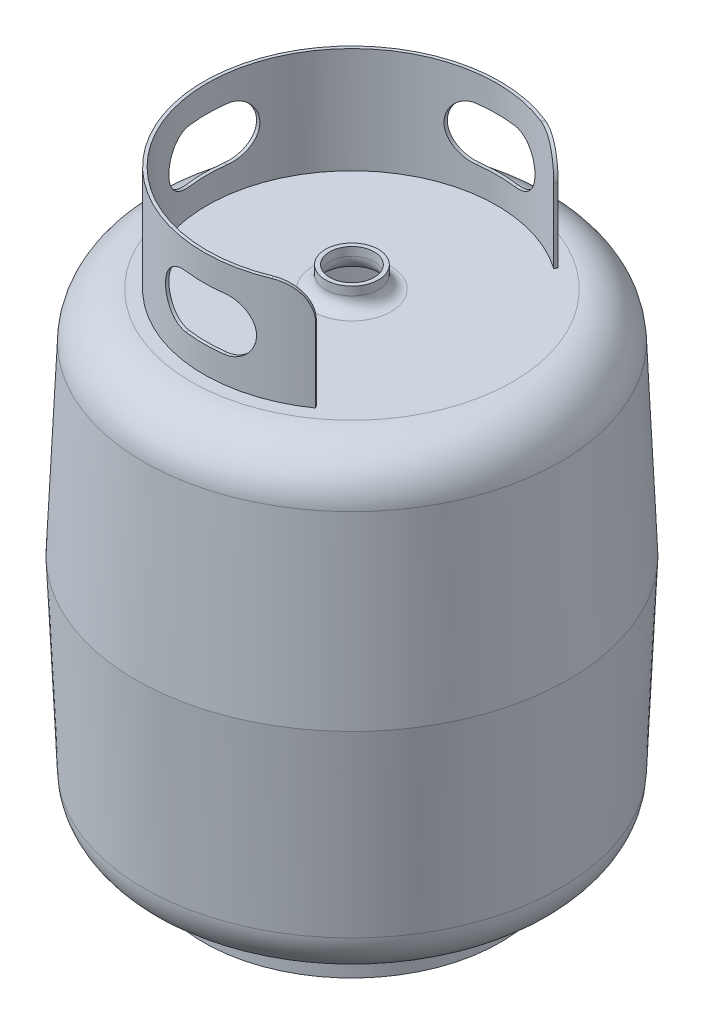
from build123d import *

# Parameters (mm, degrees)
ESQUISSE2_R                  = 139.921871599
ESQUISSE2_R_2                = 136.921871599
BOSS_EXTRU_1_DEPTH           = 30
BOSS_EXTRU_2_START           = 100
BOSS_EXTRU_2_DEPTH           = 100
CONG_1_R                     = 30
ENL_V_MAT_EXTRU_1_DEPTH      = 609.163166258
R_P_TITION_CIRCULAIRE1_COUNT = 3
R_P_TITION_CIRCULAIRE1_ANGLE = 180


with BuildPart() as part:
    # Esquisse1 → Révolution2 (revolve)
    with BuildSketch(Plane.XY, mode=Mode.PRIVATE) as r_volution2_sk:
        with BuildLine():
            Line((0, 0), (151.921871599, 0))
            ThreePointArc((151.921871599, 0), (183.039959109, 12.493621707), (196.87904157, 43.037127569))
            Line((196.87904157, 43.037127569), (204.496255083, 217.5))
            Line((204.496255083, 217.5), (196.87904157, 391.962872431))
            ThreePointArc((196.87904157, 391.962872431), (183.039959109, 422.506378293), (151.921871599, 435))
            Line((151.921871599, 435), (37, 435))
            ThreePointArc((37, 435), (28.514718626, 438.514718626), (25, 447))
            Line((25, 447), (25, 455))
            Line((25, 455), (21, 455))
            Line((21, 455), (21, 447))
            ThreePointArc((21, 447), (25.686291501, 435.686291501), (37, 431))
            Line((37, 431), (151.921871599, 431))
            ThreePointArc((151.921871599, 431), (180.273906886, 419.616922444), (192.882848683, 391.788394882))
            Line((192.882848683, 391.788394882), (200.492444342, 217.5))
            Line((200.492444342, 217.5), (192.882848683, 43.211605118))
            ThreePointArc((192.882848683, 43.211605118), (180.273906886, 15.383077556), (151.921871599, 4))
            Line((151.921871599, 4), (0, 4))
            Line((0, 4), (0, 0))
        make_face()
    revolve(r_volution2_sk.sketch.rotate(Axis((0, 0, 0), (0, 1, 0)), 90), axis=Axis((0, 0, 0), (0, 1, 0)))

    # Esquisse2 → Boss.-Extru.1 (add)
    with BuildSketch(Plane.XZ):
        with Locations(Location((0, 0, 0), (0, 0, 270))):
            Circle(ESQUISSE2_R)
        with Locations(Location((0, 0, 0), (0, 0, 270))):
            Circle(ESQUISSE2_R_2, mode=Mode.SUBTRACT)
    extrude(amount=BOSS_EXTRU_1_DEPTH)

    # Esquisse3 → Boss.-Extru.2 (add)
    with BuildSketch(Plane(origin=(0, 435, 0), x_dir=(1, 0, 0), z_dir=(0, 1, 0)).offset(BOSS_EXTRU_2_START)):
        with BuildLine():
            ThreePointArc((78.53515917, -112.159831028), (-136.921871599, 0), (78.53515917, 112.159831028))
            Line((78.53515917, 112.159831028), (80.255888479, 114.617287161))
            ThreePointArc((80.255888479, 114.617287161), (-139.921871599, 0), (80.255888479, -114.617287161))
            Line((80.255888479, -114.617287161), (78.53515917, -112.159831028))
        make_face()
    extrude(amount=-BOSS_EXTRU_2_DEPTH)

    # Congé1
    # the kernel refuses this fillet: 30 mm, written as the material it takes off along each edge
    with BuildSketch(Plane(origin=(123.274121205, 535, 176.053690482), x_dir=(0, -1, 0), z_dir=(-0.5735764363510459, 0, -0.8191520442889919))) as cong_1_piece_1_section:
        with BuildLine():
            CenterArc((CONG_1_R, CONG_1_R), CONG_1_R, 180, 90)
            Line((0, CONG_1_R), (-CONG_1_R * 0.02, CONG_1_R))
            Line((-CONG_1_R * 0.02, CONG_1_R), (-CONG_1_R * 0.02, -CONG_1_R * 0.02))
            Line((-CONG_1_R * 0.02, -CONG_1_R * 0.02), (CONG_1_R, -CONG_1_R * 0.02))
            Line((CONG_1_R, -CONG_1_R * 0.02), (CONG_1_R, 0))
        make_face()
    cong_1_piece_1 = extrude(amount=153, mode=Mode.PRIVATE)
    cong_1_piece_1 = cong_1_piece_1 & Plane(origin=(0, 528.219783775, 0), x_dir=(0.5735764363510613, 0, -0.8191520442889811), z_dir=(0, 1, 0)) * Cylinder(139.921871599, 427, mode=Mode.PRIVATE)
    cong_1_piece_1 = cong_1_piece_1 - Plane(origin=(0, 528.219783775, 0), x_dir=(0.5735764363510598, 0, 0.8191520442889824), z_dir=(0, 1, 0)) * Cylinder(136.921871599, 427, mode=Mode.PRIVATE)
    add(cong_1_piece_1, mode=Mode.SUBTRACT)
    with BuildSketch(Plane(origin=(35.516926444, 535, -50.723427706), x_dir=(0, -1, 0), z_dir=(0.573576436351044, 0, -0.8191520442889932))) as cong_1_piece_2_section:
        with BuildLine():
            CenterArc((CONG_1_R, CONG_1_R), CONG_1_R, 180, 90)
            Line((0, CONG_1_R), (-CONG_1_R * 0.02, CONG_1_R))
            Line((-CONG_1_R * 0.02, CONG_1_R), (-CONG_1_R * 0.02, -CONG_1_R * 0.02))
            Line((-CONG_1_R * 0.02, -CONG_1_R * 0.02), (CONG_1_R, -CONG_1_R * 0.02))
            Line((CONG_1_R, -CONG_1_R * 0.02), (CONG_1_R, 0))
        make_face()
    cong_1_piece_2 = extrude(amount=153, mode=Mode.PRIVATE)
    cong_1_piece_2 = cong_1_piece_2 & Plane(origin=(0, 528.219668957, 0), x_dir=(0.5735764363510613, 0, -0.8191520442889811), z_dir=(0, 1, 0)) * Cylinder(139.921871599, 426, mode=Mode.PRIVATE)
    cong_1_piece_2 = cong_1_piece_2 - Plane(origin=(0, 528.219668957, 0), x_dir=(0.5735764363510598, 0, 0.8191520442889824), z_dir=(0, 1, 0)) * Cylinder(136.921871599, 426, mode=Mode.PRIVATE)
    add(cong_1_piece_2, mode=Mode.SUBTRACT)

    # Esquisse6 → Enlèv. mat.-Extru.1 (cut, through all)
    with BuildSketch(Plane.XY):
        with BuildLine():
            Line((18, 460), (-18, 460))
            ThreePointArc((-18, 460), (-43, 485), (-18, 510))
            Line((-18, 510), (18, 510))
            ThreePointArc((18, 510), (43, 485), (18, 460))
        make_face()
    enl_v_mat_extru_1 = extrude(amount=ENL_V_MAT_EXTRU_1_DEPTH, mode=Mode.SUBTRACT)

    # Répétition circulaire1: Enlèv. mat.-Extru.1 ×3 about axis
    r_p_tition_circulaire1_axis = Axis((0, 535, 0), (0, -1, 0))
    for i in range(1, R_P_TITION_CIRCULAIRE1_COUNT):
        add(enl_v_mat_extru_1.rotate(r_p_tition_circulaire1_axis, i * R_P_TITION_CIRCULAIRE1_ANGLE / (R_P_TITION_CIRCULAIRE1_COUNT - 1)), mode=Mode.SUBTRACT)


solid = part.part
